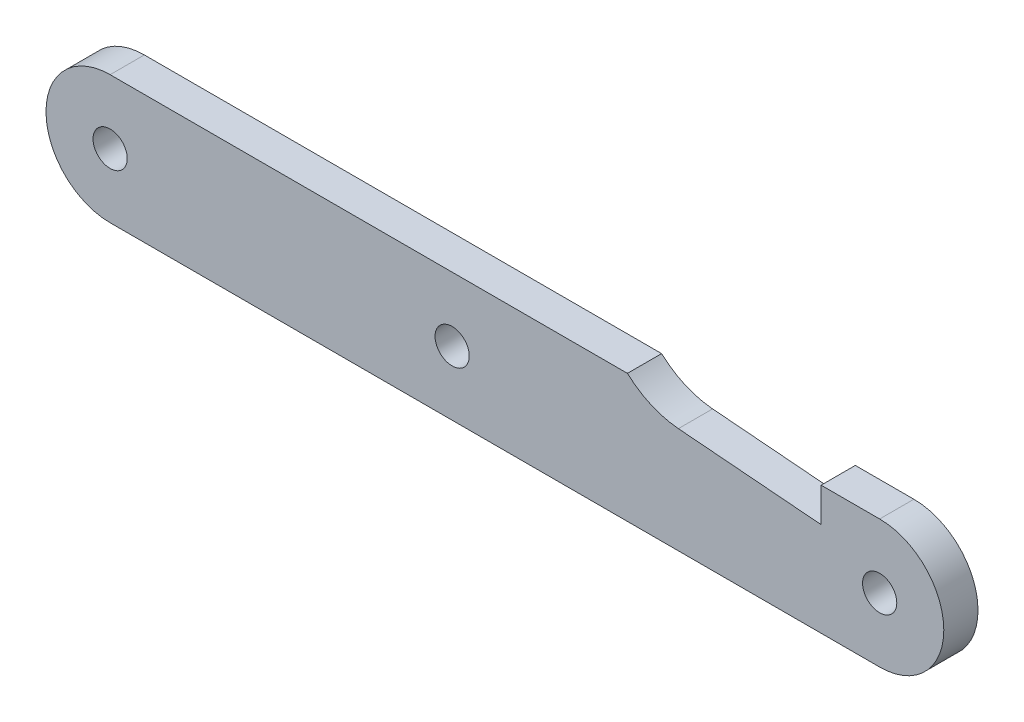
from build123d import *

# Parameters (mm, degrees)
SKETCH1_R           = 2
BOSS_EXTRUDE1_DEPTH = 4
FILLET1_R           = 10


with BuildPart() as part:
    # Sketch1 → Boss-Extrude1 (new body)
    with BuildSketch(Plane.XY):
        with BuildLine():
            Line((0, 7.5), (60.5, 7.5))
            Line((60.5, 7.5), (62.59580051, 5.2))
            Line((62.59580051, 5.2), (83.151712968, 3.5))
            Line((83.151712968, 3.5), (83.151712968, 7.5))
            Line((83.151712968, 7.5), (90, 7.5))
            ThreePointArc((90, 7.5), (97.5, 0), (90, -7.5))
            Line((90, -7.5), (0, -7.5))
            ThreePointArc((0, -7.5), (-7.5, 0), (0, 7.5))
        make_face()
        Circle(SKETCH1_R, mode=Mode.SUBTRACT)
        with Locations((90, 0)):
            Circle(SKETCH1_R, mode=Mode.SUBTRACT)
        with Locations((40, 0)):
            Circle(SKETCH1_R, mode=Mode.SUBTRACT)
    extrude(amount=BOSS_EXTRUDE1_DEPTH)

    # Fillet1
    # the kernel refuses this fillet: 10 mm, written as the material it adds along each edge
    with BuildSketch(Plane(origin=(62.59580051, 5.2, 0), x_dir=(-0.6735330094671406, 0.7391571451038925, 0), z_dir=(0, 0, 1))) as fillet1_piece_1:
        with BuildLine():
            CenterArc((3.972118366, -9.962911125), FILLET1_R, 94.936211763, 37.995780091)
            Line((-2.839179513, -2.641284173), (-2.97540547, -2.494851634))
            Line((-2.97540547, -2.494851634), (-0.136225958, 0.146432539))
            Line((-0.136225958, 0.146432539), (0, 0.2))
            ThreePointArc((0, 0.2), (1.555826129, 0.2), (3.094442936, 0.199258222))
            Line((3.094442936, 0.199258222), (3.111652259, 0))
        make_face()
    extrude(amount=4)


solid = part.part
